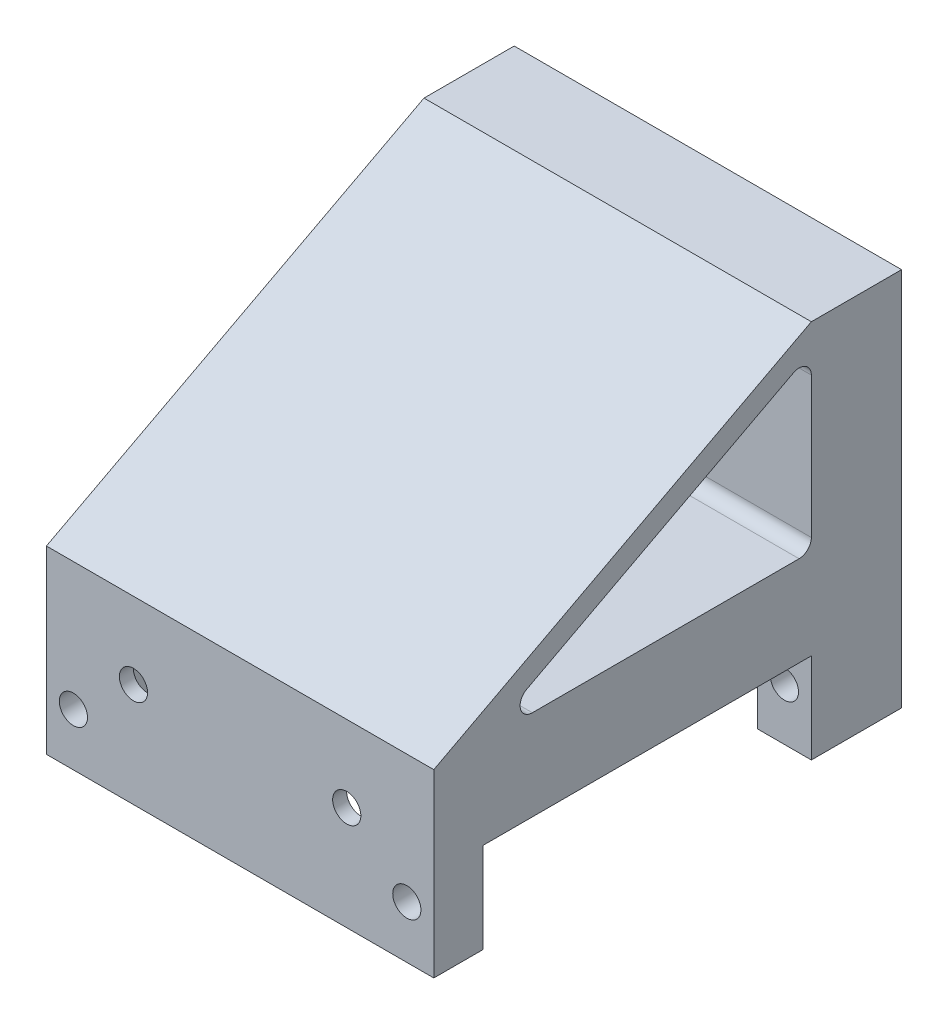
from build123d import *

# Parameters (mm, degrees)
BOSS_EXTRUDE1_DEPTH = 40.132
FILLET1_R           = 1.27
SKETCH2_W           = 28.2956
SKETCH2_H           = 34.036
CUT_EXTRUDE1_DEPTH  = 4.4704
CHAMFER1_SIZE       = 5.08
CHAMFER1_SIZE_2     = 7.53140972
SKETCH3_R           = 1.4605
CUT_EXTRUDE2_DEPTH  = 73.627884767
CUT_EXTRUDE4_REACH  = 76.199
SKETCH4_W           = 28.956
SKETCH4_H           = 41.3004


with BuildPart() as part:
    # Sketch1 → Boss-Extrude1 (new body)
    with BuildSketch(Plane(origin=(0, 0, 0), x_dir=(0, 0, -1), z_dir=(1, 0, 0))):
        Polygon((0, -3.052283086), (0, 36.270517883), (-9.3472, 36.270517883), (-48.4632, 15.642116914), (-48.4632, -3.052283086), (-43.3832, -3.052283086), (-43.3832, 6.294916914), (-9.3472, 6.294916914), (-9.3472, -3.052283086), align=None)
        Polygon((-43.3832, 15.642116914), (-9.3472, 33.59150477), (-9.3472, 15.642116914), align=None, mode=Mode.SUBTRACT)
    extrude(amount=BOSS_EXTRUDE1_DEPTH)

    # Fillet1
    fillet1_edges = [part.edges().sort_by_distance(p)[0] for p in [
        (20.066, 15.642116914, 43.3832),
        (20.066, 15.642116914, 9.3472),
        (20.066, 33.59150477, 9.3472),
    ]]
    fillet(fillet1_edges, radius=FILLET1_R)

    # Sketch2 → Cut-Extrude1 (cut)
    with BuildSketch(Plane.XZ.offset(-6.294916914)):
        with Locations((20.066, 26.3652)):
            Rectangle(SKETCH2_W, SKETCH2_H)
    extrude(amount=-CUT_EXTRUDE1_DEPTH, mode=Mode.SUBTRACT)

    # Chamfer1
    # the kernel refuses this chamfer: 7.53140972, 5.08 mm, written as the material it takes off along each edge
    with BuildSketch(Plane(origin=(5.9182, 6.294916914, 9.3472), x_dir=(-0.9988697089125115, -0.04753214298802862, 0), z_dir=(0, 0, 1))) as chamfer1_piece_1_section:
        Polygon((CHAMFER1_SIZE * 0.998869708913, -CHAMFER1_SIZE * 0.047532142988), (-CHAMFER1_SIZE_2 * 0.0475321429883, -CHAMFER1_SIZE_2 * 0.998869708918), (0, 0), align=None)
    chamfer1_piece_1 = extrude(amount=34.036, mode=Mode.PRIVATE)
    chamfer1_piece_1 = split(chamfer1_piece_1, bisect_by=Plane(origin=(4.025982399, 10.765316914, 26.3652), z_dir=(0, -1, 0)), keep=Keep.TOP, mode=Mode.PRIVATE)
    add(chamfer1_piece_1, mode=Mode.SUBTRACT)
    with BuildSketch(Plane(origin=(34.2138, 6.294916914, 43.3832), x_dir=(0.9988697089125117, -0.0475321429880285, 0), z_dir=(0, 0, -1))) as chamfer1_piece_2_section:
        Polygon((CHAMFER1_SIZE * 0.998869708913, -CHAMFER1_SIZE * 0.047532142988), (-CHAMFER1_SIZE_2 * 0.0475321429883, -CHAMFER1_SIZE_2 * 0.998869708918), (0, 0), align=None)
    chamfer1_piece_2 = extrude(amount=34.036, mode=Mode.PRIVATE)
    chamfer1_piece_2 = split(chamfer1_piece_2, bisect_by=Plane(origin=(36.106017601, 10.765316914, 26.3652), z_dir=(0, -1, 0)), keep=Keep.TOP, mode=Mode.PRIVATE)
    add(chamfer1_piece_2, mode=Mode.SUBTRACT)

    # Sketch3 → Cut-Extrude2 (cut, through all)
    with BuildSketch(Plane(origin=(0, 0, 0), x_dir=(-1, 0, 0), z_dir=(0, 0, -1))):
        with Locations((-37.338, 2.383316914)):
            Circle(SKETCH3_R)
        with Locations((-31.115, 7.717316914)):
            Circle(SKETCH3_R)
        with Locations((-9.017, 7.717316914)):
            Circle(SKETCH3_R)
        with Locations((-2.794, 2.383316914)):
            Circle(SKETCH3_R)
    extrude(amount=-CUT_EXTRUDE2_DEPTH, mode=Mode.SUBTRACT)

    # Cut-Extrude4: up to this face of the body (flat: up to its plane)
    cut_extrude4_end = Plane(part.part.faces().sort_by_distance((20.066, 10.765316914, 26.3652))[0])
    # Sketch4 → Cut-Extrude4 (cut, up to the picked face)
    with BuildSketch(Plane.XZ.offset(3.052283086), mode=Mode.PRIVATE) as cut_extrude4_sk1:
        with Locations((20.066, 26.3652)):
            Rectangle(SKETCH4_W, SKETCH4_H)
    cut_extrude4_tool1 = split(extrude(cut_extrude4_sk1.sketch, amount=-CUT_EXTRUDE4_REACH, mode=Mode.PRIVATE), bisect_by=cut_extrude4_end, keep=Keep.BOTH, mode=Mode.PRIVATE)
    add(cut_extrude4_tool1.solids().sort_by(Axis((20.066, -3.052283, 26.3652), (0, 1, 0)))[0], mode=Mode.SUBTRACT)


solid = part.part
